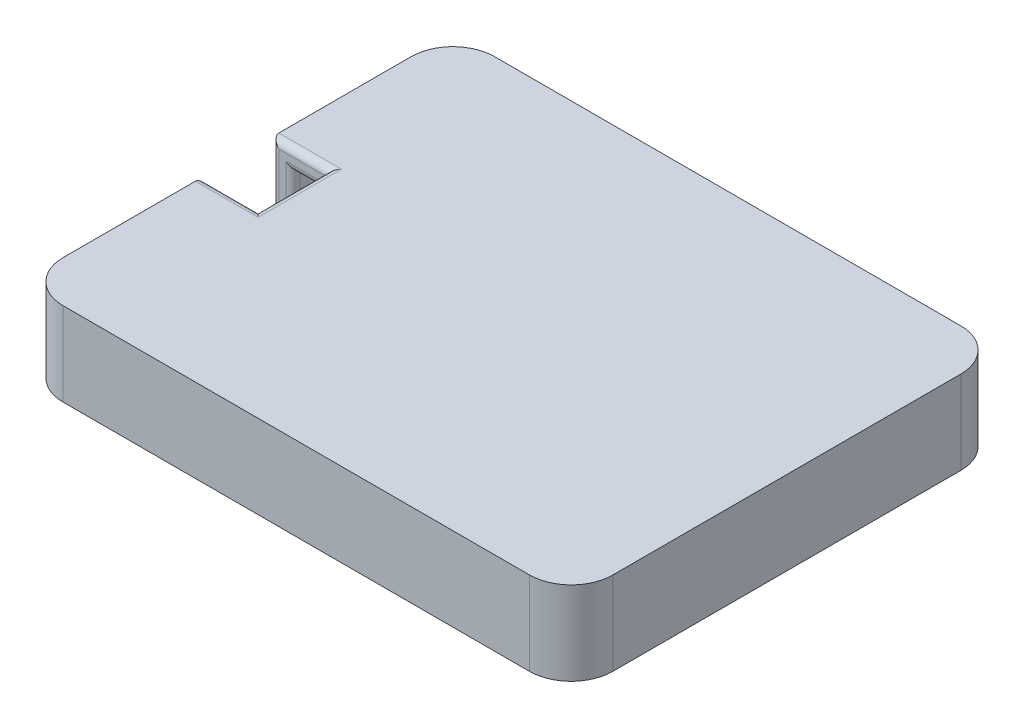
from build123d import *

# Parameters (mm, degrees)
RESSALTO_EXTRUS_O1_DEPTH = 12
CASCA1_T                 = -3
ESBO_O3_W                = 8
ESBO_O3_H                = 10
CORTE_EXTRUS_O2_DEPTH    = 127.530397546
FILETE1_R                = 1


with BuildPart() as part:
    # Esboço2 → Ressalto-extrusão1 (new body)
    with BuildSketch(Plane(origin=(0, 5.997724004, 0), x_dir=(1, 0, 0), z_dir=(0, 1, 0))):
        with BuildLine():
            Line((-58.558389249, -55.520655269), (-58.558389249, -105.520655269))
            ThreePointArc((-58.558389249, -105.520655269), (-56.801029936, -109.763295956), (-52.558389249, -111.520655269))
            Line((-52.558389249, -111.520655269), (14.441610751, -111.520655269))
            ThreePointArc((14.441610751, -111.520655269), (18.684251438, -109.763295956), (20.441610751, -105.520655269))
            Line((20.441610751, -105.520655269), (20.441610751, -55.520655269))
            ThreePointArc((20.441610751, -55.520655269), (18.684251438, -51.278014582), (14.441610751, -49.520655269))
            Line((14.441610751, -49.520655269), (-52.558389249, -49.520655269))
            ThreePointArc((-52.558389249, -49.520655269), (-56.801029936, -51.278014582), (-58.558389249, -55.520655269))
        make_face()
    extrude(amount=-RESSALTO_EXTRUS_O1_DEPTH)

    # Casca1
    casca1_openings = [part.faces().sort_by_distance(p)[0] for p in [
        (-19.058389249, -6.002275996, 80.520655269),
    ]]
    offset(amount=CASCA1_T, openings=casca1_openings, kind=Kind.INTERSECTION)

    # Esboço3 → Corte-extrusão2 (cut, through all)
    with BuildSketch(Plane(origin=(0, 5.997724004, 0), x_dir=(1, 0, 0), z_dir=(0, 1, 0))):
        with Locations((-54.558389249, -80.520655269)):
            Rectangle(ESBO_O3_W, ESBO_O3_H)
    extrude(amount=-CORTE_EXTRUS_O2_DEPTH, mode=Mode.SUBTRACT)

    # Filete1
    filete1_edges = [part.edges().sort_by_distance(p)[0] for p in [
        (-50.558389249, 2.997724004, 80.520655269),
        (-53.058389249, 2.997724004, 85.520655269),
        (-53.058389249, 2.997724004, 75.520655269),
        (-54.558389249, 5.997724004, 85.520655269),
        (-50.558389249, 5.997724004, 80.520655269),
        (-54.558389249, 5.997724004, 75.520655269),
        (-55.558389249, -1.502275996, 85.520655269),
        (-55.558389249, -1.502275996, 75.520655269),
        (-58.558389249, -0.002275996, 75.520655269),
        (-58.558389249, -0.002275996, 85.520655269),
    ]]
    fillet(filete1_edges, radius=FILETE1_R)


solid = part.part
